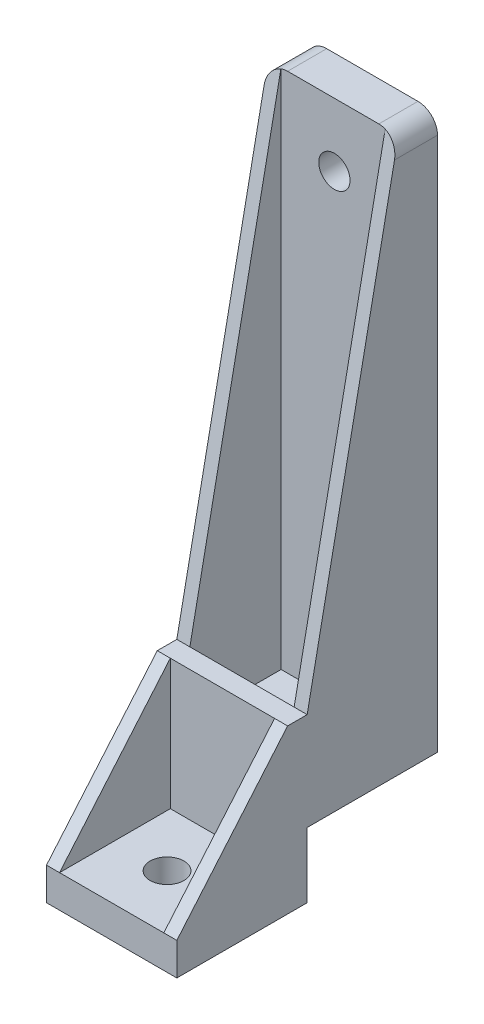
from build123d import *

# Parameters (mm, degrees)
SKETCH1_W               = 20
SKETCH1_H               = 20
BOSS_EXTRUDE1_DEPTH     = 5
SKETCH2_W               = 20
SKETCH2_H               = 3
BOSS_EXTRUDE2_DEPTH     = 20
CUT_EXTRUDE1_DEPTH      = 25.494897428
CUT_EXTRUDE1_DEPTH_BACK = 25.494897428
SKETCH3_R               = 2.6
BOSS_EXTRUDE3_DEPTH     = 2
BOSS_EXTRUDE4_DEPTH     = 2
SKETCH6_W               = 2
SKETCH6_H               = 3
SKETCH6_W_2             = 4
BOSS_EXTRUDE5_DEPTH     = 0.8
SKETCH9_W               = 20
SKETCH9_H               = 3
BOSS_EXTRUDE8_DEPTH     = 45
BOSS_EXTRUDE9_DEPTH     = 20
SKETCH13_W              = 20
SKETCH13_H              = 3
BOSS_EXTRUDE12_DEPTH    = 80
SKETCH16_W              = 3
SKETCH16_H              = 45
CUT_EXTRUDE3_DEPTH      = 80
SKETCH22_W              = 20
SKETCH22_H              = 80
BOSS_EXTRUDE15_DEPTH    = 3
BOSS_EXTRUDE16_DEPTH    = 2
BOSS_EXTRUDE17_DEPTH    = 2
FILLET2_R               = 3
SKETCH26_R              = 2.4
CUT_EXTRUDE5_DEPTH      = 9


with BuildPart() as part:
    # Sketch1 → Boss-Extrude1 (new body)
    with BuildSketch(Plane(origin=(0, 0, 0), x_dir=(1, 0, 0), z_dir=(0, 1, 0))):
        Rectangle(SKETCH1_W, SKETCH1_H)
    extrude(amount=BOSS_EXTRUDE1_DEPTH)

    # Sketch2 → Boss-Extrude2 (add)
    with BuildSketch(Plane(origin=(0, 5, 0), x_dir=(1, 0, 0), z_dir=(0, 1, 0))):
        with Locations((0, 8.5)):
            Rectangle(SKETCH2_W, SKETCH2_H)
    extrude(amount=BOSS_EXTRUDE2_DEPTH)

    # Sketch3 → Cut-Extrude1 (cut, two sides: drawn at the far end of the back side and taken through both)
    with BuildSketch(Plane(origin=(0, 5, 0), x_dir=(1, 0, 0), z_dir=(0, 1, 0)).offset(-CUT_EXTRUDE1_DEPTH_BACK)):
        with Locations(Location((0, -1.5, 0), (0, 0, 270))):
            Circle(SKETCH3_R)
    extrude(amount=CUT_EXTRUDE1_DEPTH + CUT_EXTRUDE1_DEPTH_BACK, mode=Mode.SUBTRACT)

    # Sketch4 → Boss-Extrude3 (add)
    with BuildSketch(Plane.ZY.offset(10)):
        Polygon((-7, 25), (10, 5), (-7, 5), align=None)
    extrude(amount=-BOSS_EXTRUDE3_DEPTH)

    # Sketch5 → Boss-Extrude4 (add)
    with BuildSketch(Plane(origin=(10, 0, 0), x_dir=(0, 0, -1), z_dir=(1, 0, 0))):
        Polygon((7, 25), (-10, 5), (7, 5), align=None)
    extrude(amount=-BOSS_EXTRUDE4_DEPTH)

    # Sketch6 → Boss-Extrude5 (add)
    with BuildSketch(Plane(origin=(0, 0, 0), x_dir=(-1, 0, 0), z_dir=(0, -1, 0))):
        with Locations((-1, 4.297300947)):
            Rectangle(SKETCH6_W, SKETCH6_H)
        with Locations((1, 4.297300947)):
            Rectangle(SKETCH6_W, SKETCH6_H)
        with Locations((0, -7.297300947)):
            Rectangle(SKETCH6_W_2, SKETCH6_H)
    extrude(amount=BOSS_EXTRUDE5_DEPTH)

    # Sketch9 → Boss-Extrude8 (add)
    with BuildSketch(Plane(origin=(0, 25, 0), x_dir=(1, 0, 0), z_dir=(0, 1, 0))):
        with Locations((0, 8.5)):
            Rectangle(SKETCH9_W, SKETCH9_H)
    extrude(amount=BOSS_EXTRUDE8_DEPTH)

    # Sketch12 → Boss-Extrude9 (add)
    with BuildSketch(Plane(origin=(0, 0, -10), x_dir=(-1, 0, 0), z_dir=(0, 0, -1))):
        Polygon((0, 10), (-10, 10), (-10, 15), (10, 15), (10, 10), align=None)
    extrude(amount=BOSS_EXTRUDE9_DEPTH)

    # Sketch13 → Boss-Extrude12 (add)
    with BuildSketch(Plane(origin=(0, 15, 0), x_dir=(1, 0, 0), z_dir=(0, 1, 0))):
        with Locations((0, 28.5)):
            Rectangle(SKETCH13_W, SKETCH13_H)
    extrude(amount=BOSS_EXTRUDE12_DEPTH)

    # Sketch16 → Cut-Extrude3 (cut)
    with BuildSketch(Plane.ZY.offset(10)):
        with Locations((-8.5, 47.5)):
            Rectangle(SKETCH16_W, SKETCH16_H)
    extrude(amount=-CUT_EXTRUDE3_DEPTH, mode=Mode.SUBTRACT)

    # Sketch22 → Boss-Extrude15 (add)
    with BuildSketch(Plane.XY.offset(-27)):
        with Locations((0, 55)):
            Rectangle(SKETCH22_W, SKETCH22_H)
    extrude(amount=BOSS_EXTRUDE15_DEPTH)

    # Sketch23 → Boss-Extrude16 (add)
    with BuildSketch(Plane.ZY.offset(10)):
        Polygon((-24, 95), (-10, 25), (-10, 15), (-24, 15), align=None)
    extrude(amount=-BOSS_EXTRUDE16_DEPTH)

    # Sketch24 → Boss-Extrude17 (add)
    with BuildSketch(Plane(origin=(10, 0, 0), x_dir=(0, 0, -1), z_dir=(1, 0, 0))):
        Polygon((24, 95), (10, 25), (10, 15), (24, 15), align=None)
    extrude(amount=-BOSS_EXTRUDE17_DEPTH)

    # Fillet2
    # the kernel refuses this fillet: 3 mm, written as the material it takes off along each edge
    with BuildSketch(Plane(origin=(-10, 95, -16.5), x_dir=(0, -1, 0), z_dir=(0, 0, -1)), Plane(origin=(10, 95, -37.5), x_dir=(0, -1, 0), z_dir=(0, 0, 1))) as fillet2_piece_1:
        with BuildLine():
            CenterArc((FILLET2_R, -FILLET2_R), FILLET2_R, 90, 90)
            Line((0, -FILLET2_R), (0, 0))
            Line((0, 0), (FILLET2_R, 0))
        make_face()
    extrude(amount=21, mode=Mode.SUBTRACT)

    # Sketch26 → Cut-Extrude5 (cut)
    with BuildSketch(Plane(origin=(0, 0, -30), x_dir=(-1, 0, 0), z_dir=(0, 0, -1))):
        with Locations((-0.179346542, 85.282473515)):
            Circle(SKETCH26_R)
        with Locations((-0.179346542, 20.282473515)):
            Circle(SKETCH26_R)
    extrude(amount=-CUT_EXTRUDE5_DEPTH, mode=Mode.SUBTRACT)


solid = part.part
